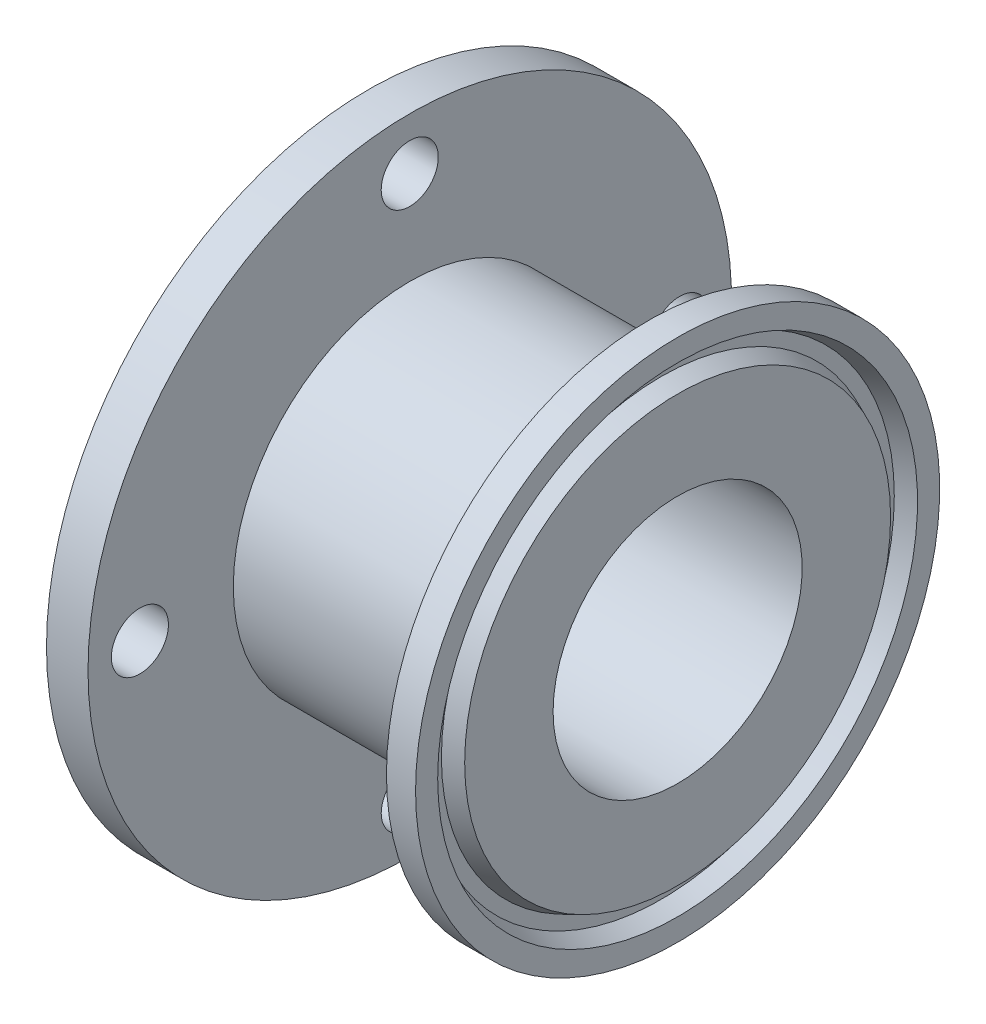
from build123d import *

# Parameters (mm, degrees)
M5_START                     = -14.904727216
M5_CLEARANCE_HOLE1_OUTLINE_R = 2.75
M5_CLEARANCE_HOLE1_DEPTH     = 4
CIRPATTERN1_COUNT            = 4


# Read off the part's stored shape, not the designer's step: M5 Clearance Hole1
with BuildPart() as part:
    # Sketch1 → Revolve1 (revolve)
    with BuildSketch(Plane.XY, mode=Mode.PRIVATE) as revolve1_sk:
        with BuildLine():
            Line((-14.904727216, 12), (-14.904727216, 31))
            Line((-14.904727216, 31), (-10.904727216, 31))
            Line((-10.904727216, 31), (-10.904727216, 17))
            Line((-10.904727216, 17), (8.294935567, 17))
            ThreePointArc((8.294935567, 17), (8.950533434, 17.206709213), (9.369004233, 17.752070976))
            Line((9.369004233, 17.752070976), (12.098027216, 25.25))
            Line((12.098027216, 25.25), (14.904727216, 25.25))
            Line((14.904727216, 25.25), (14.904727216, 23.1186))
            Line((14.904727216, 23.1186), (13.329927216, 22.450137059))
            Line((13.329927216, 22.450137059), (13.329927216, 21.187062941))
            Line((13.329927216, 21.187062941), (14.904727216, 20.5186))
            Line((14.904727216, 20.5186), (14.904727216, 12))
            Line((14.904727216, 12), (-14.904727216, 12))
        make_face()
    revolve(revolve1_sk.sketch.rotate(Axis((0, 0, 0), (1, 0, 0)), 90), axis=Axis((0, 0, 0), (1, 0, 0)))

    # M5 Clearance Hole1 outline → M5 Clearance Hole1 (cut)
    with BuildSketch(Plane.YZ.offset(M5_START)):
        with Locations((0, 26)):
            Circle(M5_CLEARANCE_HOLE1_OUTLINE_R)
    m5_clearance_hole1 = extrude(amount=M5_CLEARANCE_HOLE1_DEPTH, mode=Mode.SUBTRACT)

    # CirPattern1: M5 Clearance Hole1 ×4 about axis
    cirpattern1_axis = Axis((0, 0, 0), (1, 0, 0))
    for i in range(1, CIRPATTERN1_COUNT):
        add(m5_clearance_hole1.rotate(cirpattern1_axis, i * 360 / CIRPATTERN1_COUNT), mode=Mode.SUBTRACT)


solid = part.part
